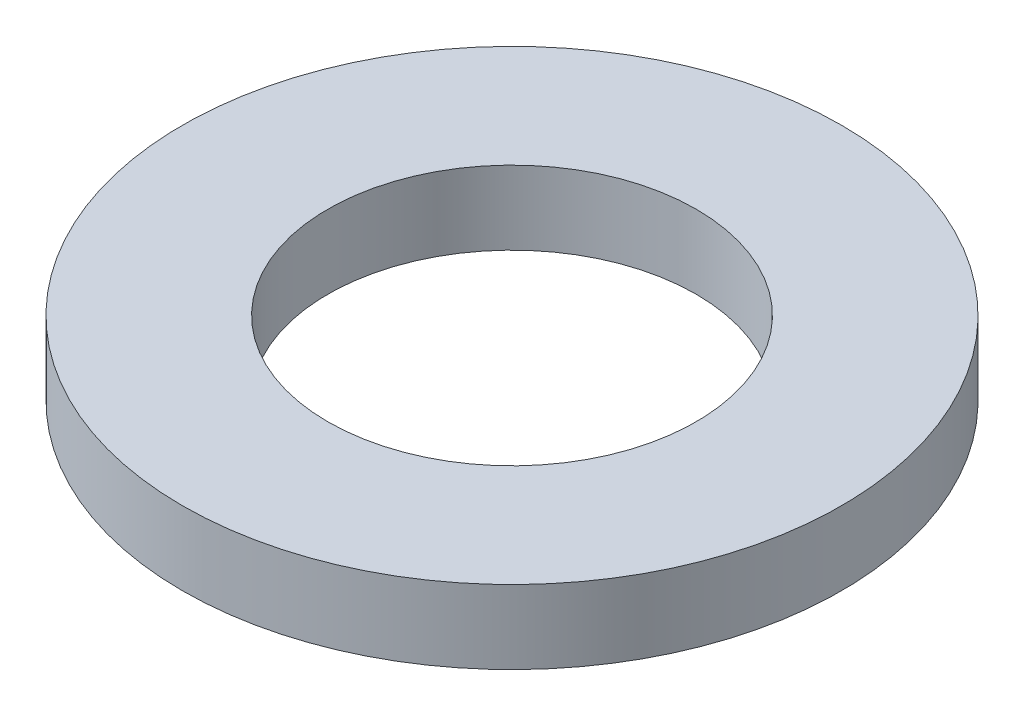
from build123d import *

# Parameters (mm, degrees)
SKETCH1_R           = 85
BOSS_EXTRUDE1_DEPTH = 19
SKETCH2_R           = 47.5
CUT_EXTRUDE1_DEPTH  = 122.70045193


with BuildPart() as part:
    # Sketch1 → Boss-Extrude1 (new body)
    with BuildSketch(Plane(origin=(0, 0, 0), x_dir=(1, 0, 0), z_dir=(0, 1, 0))):
        Circle(SKETCH1_R)
    extrude(amount=BOSS_EXTRUDE1_DEPTH)

    # Sketch2 → Cut-Extrude1 (cut, through all)
    with BuildSketch(Plane(origin=(0, 0, 0), x_dir=(1, 0, 0), z_dir=(0, 1, 0))):
        Circle(SKETCH2_R)
    extrude(amount=CUT_EXTRUDE1_DEPTH, mode=Mode.SUBTRACT)


solid = part.part
